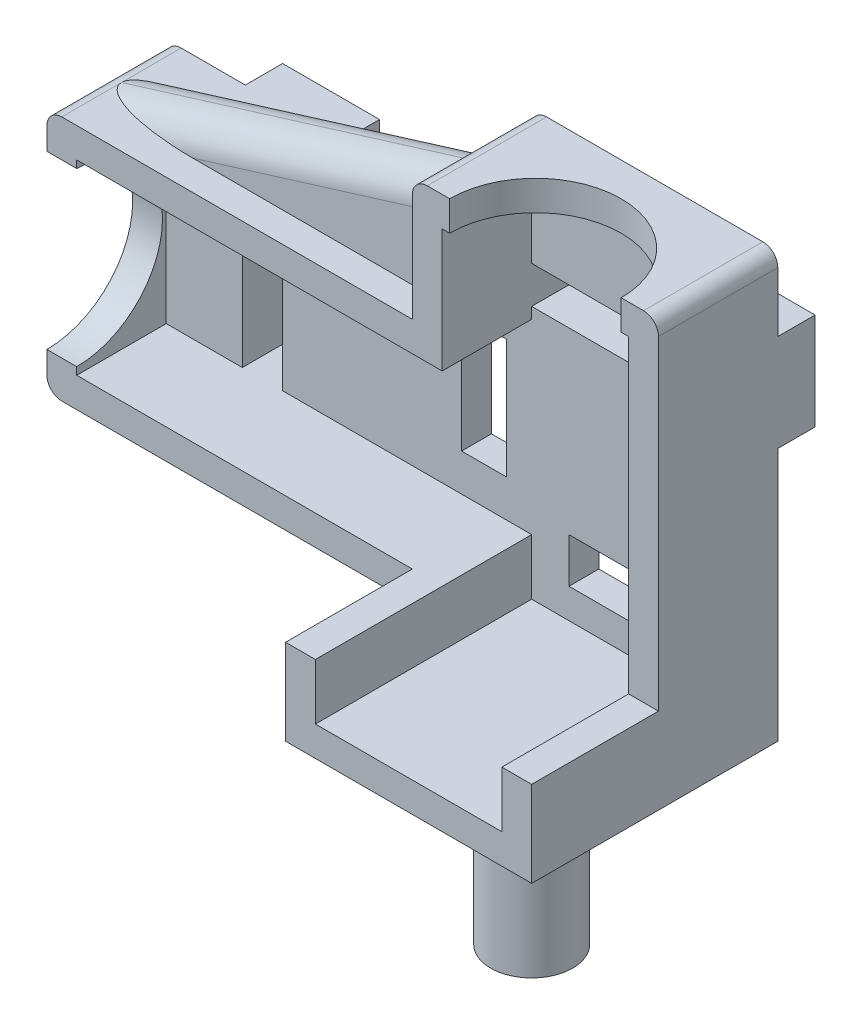
from build123d import *

# Parameters (mm, degrees)
EXTRUDE_1_DEPTH             = 8
CUT_EXTRUDE_2_DEPTH         = 6
SKETCH_3_R                  = 5.75
CUT_EXTRUDE_3_DEPTH         = 43.881377077
SKETCH_4_R                  = 5.75
CUT_EXTRUDE_4_DEPTH         = 43.285488054
SKETCH_10_W                 = 16.5
SKETCH_10_H                 = 6.5
EXTRUDE_3_DEPTH             = 2.5
EXTRUDE_4_OUTLINE_W         = 6.5
EXTRUDE_4_OUTLINE_H         = 16.5
EXTRUDE_4_DEPTH             = 2.5
SKETCH_12_W                 = 12.5
SKETCH_12_H                 = 2.5
CUT_EXTRUDE_8_DEPTH         = 37.216363705
CUT_EXTRUDE_START           = -4.5
CUT_EXTRUDE_9_OUTLINE_W     = 2.7
CUT_EXTRUDE_9_OUTLINE_H     = 12.5
CUT_EXTRUDE_9_DEPTH         = 4.5
EXTRUDE_5_REACH             = 39.227
SKETCH_15_W                 = 16.5
SKETCH_15_H                 = 5.75
EXTRUDE_5_DIRECTION_2_DEPTH = 8.5
SKETCH_16_W                 = 12.5
SKETCH_16_H                 = 3.75
CUT_EXTRUDE_11_DEPTH        = 14.5
SKETCH_17_R                 = 2.75
EXTRUDE_6_DEPTH             = 11.8
SKETCH_19_R                 = 1.5
CUT_EXTRUDE_12_DEPTH        = 2
SKETCH_20_W                 = 8
SKETCH_20_H                 = 3
CUT_EXTRUDE_13_DEPTH        = 45.287865155
SKETCH_22_W                 = 3
SKETCH_22_H                 = 8
CUT_EXTRUDE_14_DEPTH        = 45.287865155
FILLET_5_R                  = 1
FILLET_6_R                  = 1
RIB_3_REACH                 = 45.674
SKETCH_26_WALL_W            = 113.940860968
SKETCH_26_WALL_H            = 4
FILLET_12_R                 = 2
SKETCH_28_R                 = 0.5
EXTRUDE_7_DEPTH             = 0.8
FILLET_13_R                 = 0.15
EXTRUDE_START               = 0.8
SKETCH_31_R                 = 0.5
EXTRUDE_9_DEPTH             = 0.8
FILLET_14_R                 = 0.15
SKETCH_34_R                 = 0.5
EXTRUDE_10_DEPTH            = 0.8
FILLET_16_R                 = 0.15
SKETCH_35_R                 = 0.5
EXTRUDE_11_DEPTH            = 0.8
FILLET_17_R                 = 0.15
FILLET_5_OF_MIRROR_12_R     = 1
FILLET_6_OF_MIRROR_12_R     = 1
FILLET_12_OF_MIRROR_12_R    = 2
FILLET_13_OF_MIRROR_12_R    = 0.15
FILLET_14_OF_MIRROR_12_R    = 0.15
FILLET_16_OF_MIRROR_12_R    = 0.15
FILLET_17_OF_MIRROR_12_R    = 0.15
SKETCH_32_W                 = 34.689235526
SKETCH_32_H                 = 51.308413002
CUT_EXTRUDE_15_DEPTH        = 50.697610607


# Read off the part's stored shape, not the designer's step: 凸台-拉伸4, 切除-拉伸9
with BuildPart() as part:
    # 草图1 → 凸台-拉伸1 (new body)
    with BuildSketch(Plane.XY):
        Polygon((-8.25, 14.25), (8.25, 14.25), (8.25, 6), (32.75, 6), (32.75, -10.5), (8.25, -10.5), (8.25, -14.25), (-8.25, -14.25), align=None)
    extrude_1 = extrude(amount=-EXTRUDE_1_DEPTH)

    # 草图2 → 切除-拉伸2 (cut)
    with BuildSketch(Plane.XY):
        Polygon((-6.25, 12.25), (-6.25, -12.25), (6.25, -12.25), (6.25, -8.5), (30.75, -8.5), (30.75, 4), (6.25, 4), (6.25, 12.25), align=None)
    cut_extrude_2 = extrude(amount=-CUT_EXTRUDE_2_DEPTH, mode=Mode.SUBTRACT)

    # 草图3 → 切除-拉伸3 (cut, through all)
    with BuildSketch(Plane.XZ.offset(-12.25)):
        Circle(SKETCH_3_R)
    cut_extrude_3 = extrude(amount=-CUT_EXTRUDE_3_DEPTH, mode=Mode.SUBTRACT)

    # 草图4 → 切除-拉伸4 (cut, through all)
    with BuildSketch(Plane.ZY.offset(-30.75)):
        with Locations((0, -2.25)):
            Circle(SKETCH_4_R)
    cut_extrude_4 = extrude(amount=-CUT_EXTRUDE_4_DEPTH, mode=Mode.SUBTRACT)

    # 草图10 → 凸台-拉伸3 (add)
    with BuildSketch(Plane(origin=(0, 0, -8), x_dir=(-1, 0, 0), z_dir=(0, 0, -1))):
        with Locations((0, 6)):
            Rectangle(SKETCH_10_W, SKETCH_10_H)
    extrude_3 = extrude(amount=EXTRUDE_3_DEPTH)

    # 凸台-拉伸4 outline → 凸台-拉伸4 (add)
    with BuildSketch(Plane(origin=(0, 0, -8), x_dir=(-1, 0, 0), z_dir=(0, 0, -1))):
        with Locations((-24.2, -2.25)):
            Rectangle(EXTRUDE_4_OUTLINE_W, EXTRUDE_4_OUTLINE_H)
    extrude_4 = extrude(amount=EXTRUDE_4_DEPTH)

    # 草图12 → 切除-拉伸8 (cut, through all)
    with BuildSketch(Plane.XY.offset(-6)):
        with Locations((0, 6)):
            Rectangle(SKETCH_12_W, SKETCH_12_H)
    cut_extrude_8 = extrude(amount=-CUT_EXTRUDE_8_DEPTH, mode=Mode.SUBTRACT)

    # 切除-拉伸9 outline → 切除-拉伸9 (cut)
    with BuildSketch(Plane.XY.offset(-6).offset(CUT_EXTRUDE_START)):
        with Locations((24.3, -2.25)):
            Rectangle(CUT_EXTRUDE_9_OUTLINE_W, CUT_EXTRUDE_9_OUTLINE_H)
    cut_extrude_9 = extrude(amount=CUT_EXTRUDE_9_DEPTH, mode=Mode.SUBTRACT)

    # 草图15 → 凸台-拉伸5 (add, up to next)
    with BuildSketch(Plane.XY, mode=Mode.PRIVATE) as extrude_5_sk1:
        with Locations((0, -11.375)):
            Rectangle(SKETCH_15_W, SKETCH_15_H)
    extrude_5_tool1 = extrude(extrude_5_sk1.sketch, amount=-EXTRUDE_5_REACH, mode=Mode.PRIVATE) - part.part
    extrude_5 = extrude_5_tool1.solids().sort_by_distance((0, -11.375, 0))[0]
    add(extrude_5)

    # 草图15 → 凸台-拉伸5 direction 2 (add)
    with BuildSketch(Plane.XY):
        with Locations((0, -11.375)):
            Rectangle(SKETCH_15_W, SKETCH_15_H)
    extrude_5_direction_2 = extrude(amount=EXTRUDE_5_DIRECTION_2_DEPTH)

    # 草图16 → 切除-拉伸11 (cut)
    with BuildSketch(Plane.XY.offset(8.5)):
        with Locations((0, -10.375)):
            Rectangle(SKETCH_16_W, SKETCH_16_H)
    cut_extrude_11 = extrude(amount=-CUT_EXTRUDE_11_DEPTH, mode=Mode.SUBTRACT)

    # 草图17 → 凸台-拉伸6 (add)
    with BuildSketch(Plane.XZ.offset(14.25)):
        with Locations(Location((0, 0.25, 0), (0, 0, 270))):
            Circle(SKETCH_17_R)
    extrude_6 = extrude(amount=EXTRUDE_6_DEPTH)

    # 草图19 → 切除-拉伸12 (cut)
    with BuildSketch(Plane.XZ.offset(26.05)):
        with Locations(Location((0, 0.25, 0), (0, 0, 270))):
            Circle(SKETCH_19_R)
    cut_extrude_12 = extrude(amount=-CUT_EXTRUDE_12_DEPTH, mode=Mode.SUBTRACT)

    # 草图20 → 切除-拉伸13 (cut, through all)
    with BuildSketch(Plane.XY.offset(-6)):
        with Locations((-0.25, -8.75)):
            Rectangle(SKETCH_20_W, SKETCH_20_H)
    cut_extrude_13 = extrude(amount=-CUT_EXTRUDE_13_DEPTH, mode=Mode.SUBTRACT)

    # 草图22 → 切除-拉伸14 (cut, through all)
    with BuildSketch(Plane.XY.offset(-6)):
        with Locations((9.45, -2)):
            Rectangle(SKETCH_22_W, SKETCH_22_H)
    cut_extrude_14 = extrude(amount=-CUT_EXTRUDE_14_DEPTH, mode=Mode.SUBTRACT)

    # 圆角5
    fillet_5_edges = [part.edges().sort_by_distance(p)[0] for p in [
        (-8.25, 14.25, -4),
        (8.25, 14.25, -4),
    ]]
    fillet(fillet_5_edges, radius=FILLET_5_R)

    # 圆角6
    fillet_6_edges = [part.edges().sort_by_distance(p)[0] for p in [
        (32.75, 6, -4),
        (32.75, -10.5, -4),
    ]]
    fillet(fillet_6_edges, radius=FILLET_6_R)

    # 草图26 wall → 筋3 (add, up to next)
    with BuildSketch(Plane(origin=(20, 9.625, -4), x_dir=(0.955558946739, -0.29480010059, 0), z_dir=(0.29480010059, 0.955558946739, 0)), mode=Mode.PRIVATE) as rib_3_sk1:
        Rectangle(SKETCH_26_WALL_W, SKETCH_26_WALL_H)
    rib_3_tool1 = extrude(rib_3_sk1.sketch, amount=-RIB_3_REACH, mode=Mode.PRIVATE) - part.part
    rib_3 = rib_3_tool1.solids().sort_by_distance((20, 9.625, -4))[0]
    add(rib_3)

    # 圆角12
    fillet_12_edges = [part.edges().sort_by_distance(p)[0] for p in [
        (20, 9.625, -2),
        (20, 9.625, -6),
    ]]
    fillet(fillet_12_edges, radius=FILLET_12_R - 0.0001)  # a hair under: the kernel refuses the full size

    # 草图28 → 凸台-拉伸7 (add)
    with BuildSketch(Plane.XZ.offset(-7.25)):
        with Locations(Location((0, -8.25, 0), (0, 0, 90))):
            Circle(SKETCH_28_R)
    extrude_7 = extrude(amount=EXTRUDE_7_DEPTH)

    # 圆角13
    fillet_13_edges = [part.edges().sort_by_distance(p)[0] for p in [
        (0, 6.45, -8.75),
    ]]
    fillet(fillet_13_edges, radius=FILLET_13_R)

    # 草图31 → 凸台-拉伸9 (add)
    with BuildSketch(Plane(origin=(0, 4.75, 0), x_dir=(1, 0, 0), z_dir=(0, 1, 0)).offset(EXTRUDE_START)):
        with Locations(Location((0, 8.25, 0), (0, 0, 270))):
            Circle(SKETCH_31_R)
    extrude_9 = extrude(amount=-EXTRUDE_9_DEPTH)

    # 圆角14
    fillet_14_edges = [part.edges().sort_by_distance(p)[0] for p in [
        (0, 5.55, -8.75),
    ]]
    fillet(fillet_14_edges, radius=FILLET_14_R)

    # 草图34 → 凸台-拉伸10 (add)
    with BuildSketch(Plane.ZY.offset(-25.65)):
        with Locations((-8.25, -2.25)):
            Circle(SKETCH_34_R)
    extrude_10 = extrude(amount=EXTRUDE_10_DEPTH)

    # 圆角16
    fillet_16_edges = [part.edges().sort_by_distance(p)[0] for p in [
        (24.85, -2.25, -8.75),
    ]]
    fillet(fillet_16_edges, radius=FILLET_16_R)

    # 草图35 → 凸台-拉伸11 (add)
    with BuildSketch(Plane(origin=(22.95, 0, 0), x_dir=(0, 0, -1), z_dir=(1, 0, 0)).offset(EXTRUDE_START)):
        with Locations(Location((8.25, -2.25, 0), (0, 0, 180))):
            Circle(SKETCH_35_R)
    extrude_11 = extrude(amount=-EXTRUDE_11_DEPTH)

    # 圆角17
    fillet_17_edges = [part.edges().sort_by_distance(p)[0] for p in [
        (23.75, -2.25, -8.75),
    ]]
    fillet(fillet_17_edges, radius=FILLET_17_R)


with BuildPart() as mirror_12_1:
    # 镜向12: 凸台-拉伸1 across plane
    add(extrude_1.mirror(Plane.ZY.offset(8.25)))

    # Mirror 12 2: 切除-拉伸2, 切除-拉伸3, 切除-拉伸4 across plane
    add(cut_extrude_2.mirror(Plane.ZY.offset(8.25)), mode=Mode.SUBTRACT)
    add(cut_extrude_3.mirror(Plane.ZY.offset(8.25)), mode=Mode.SUBTRACT)
    add(cut_extrude_4.mirror(Plane.ZY.offset(8.25)), mode=Mode.SUBTRACT)


with BuildPart() as mirror_12_3_1:
    # Mirror 12 3: 凸台-拉伸3, 凸台-拉伸4 across plane
    add(extrude_3.mirror(Plane.ZY.offset(8.25)))
    add(extrude_4.mirror(Plane.ZY.offset(8.25)))


with BuildPart() as mirror_12_4_tool:
    # Mirror 12 4: 切除-拉伸8, 切除-拉伸9 across plane
    add(cut_extrude_8.mirror(Plane.ZY.offset(8.25)))
    add(cut_extrude_9.mirror(Plane.ZY.offset(8.25)))


with BuildPart() as mirror_12_1_1:
    add(mirror_12_1.part)

    # Mirror 12 4: cut by mirror_12_4_tool
    add(mirror_12_4_tool.part, mode=Mode.SUBTRACT)


with BuildPart() as mirror_12_3_1_1:
    add(mirror_12_3_1.part)

    # Mirror 12 4: cut by mirror_12_4_tool
    add(mirror_12_4_tool.part, mode=Mode.SUBTRACT)


with BuildPart() as mirror_12_5_1:
    # Mirror 12 5: 凸台-拉伸5, 凸台-拉伸5 direction 2 across plane
    add(extrude_5.mirror(Plane.ZY.offset(8.25)))
    add(extrude_5_direction_2.mirror(Plane.ZY.offset(8.25)))

    # Mirror 12 6: 切除-拉伸11 across plane
    add(cut_extrude_11.mirror(Plane.ZY.offset(8.25)), mode=Mode.SUBTRACT)


with BuildPart() as mirror_12_7_1:
    # Mirror 12 7: 凸台-拉伸6 across plane
    add(extrude_6.mirror(Plane.ZY.offset(8.25)))


with BuildPart() as mirror_12_8_tool:
    # Mirror 12 8: 切除-拉伸12, 切除-拉伸13, 切除-拉伸14 across plane
    add(cut_extrude_12.mirror(Plane.ZY.offset(8.25)))
    add(cut_extrude_13.mirror(Plane.ZY.offset(8.25)))
    add(cut_extrude_14.mirror(Plane.ZY.offset(8.25)))


with BuildPart() as mirror_12_1_2:
    add(mirror_12_1_1.part)

    # Mirror 12 8: cut by mirror_12_8_tool
    add(mirror_12_8_tool.part, mode=Mode.SUBTRACT)

    # 圆角5 of 镜向12
    fillet_5_of_mirror_12_edges = [mirror_12_1_2.edges().sort_by_distance(p)[0] for p in [
        (-8.25, 14.25, -4),
        (-24.75, 14.25, -4),
    ]]
    fillet(fillet_5_of_mirror_12_edges, radius=FILLET_5_OF_MIRROR_12_R)

    # 圆角6 of 镜向12
    fillet_6_of_mirror_12_edges = [mirror_12_1_2.edges().sort_by_distance(p)[0] for p in [
        (-49.25, 6, -4),
        (-49.25, -10.5, -4),
    ]]
    fillet(fillet_6_of_mirror_12_edges, radius=FILLET_6_OF_MIRROR_12_R)


with BuildPart() as mirror_12_7_1_1:
    add(mirror_12_7_1.part)

    # Mirror 12 8: cut by mirror_12_8_tool
    add(mirror_12_8_tool.part, mode=Mode.SUBTRACT)


with BuildPart() as mirror_12_9_1:
    # Mirror 12 9: 筋3, 凸台-拉伸7, 凸台-拉伸9, 凸台-拉伸10, 凸台-拉伸11 across plane
    add(rib_3.mirror(Plane.ZY.offset(8.25)))
    add(extrude_7.mirror(Plane.ZY.offset(8.25)))
    add(extrude_9.mirror(Plane.ZY.offset(8.25)))
    add(extrude_10.mirror(Plane.ZY.offset(8.25)))
    add(extrude_11.mirror(Plane.ZY.offset(8.25)))

    # 圆角12 of 镜向12
    fillet_12_of_mirror_12_edges = [mirror_12_9_1.edges().sort_by_distance(p)[0] for p in [
        (-36.5, 9.625, -2),
        (-36.5, 9.625, -6),
    ]]
    fillet(fillet_12_of_mirror_12_edges, radius=FILLET_12_OF_MIRROR_12_R - 0.0001)  # a hair under: the kernel refuses the full size

    # 圆角13 of 镜向12
    fillet_13_of_mirror_12_edges = [mirror_12_9_1.edges().sort_by_distance(p)[0] for p in [
        (-16.5, 6.45, -8.75),
    ]]
    fillet(fillet_13_of_mirror_12_edges, radius=FILLET_13_OF_MIRROR_12_R)

    # 圆角14 of 镜向12
    fillet_14_of_mirror_12_edges = [mirror_12_9_1.edges().sort_by_distance(p)[0] for p in [
        (-16.5, 5.55, -8.75),
    ]]
    fillet(fillet_14_of_mirror_12_edges, radius=FILLET_14_OF_MIRROR_12_R)

    # 圆角16 of 镜向12
    fillet_16_of_mirror_12_edges = [mirror_12_9_1.edges().sort_by_distance(p)[0] for p in [
        (-41.35, -2.25, -8.75),
    ]]
    fillet(fillet_16_of_mirror_12_edges, radius=FILLET_16_OF_MIRROR_12_R)

    # 圆角17 of 镜向12
    fillet_17_of_mirror_12_edges = [mirror_12_9_1.edges().sort_by_distance(p)[0] for p in [
        (-40.25, -2.25, -8.75),
    ]]
    fillet(fillet_17_of_mirror_12_edges, radius=FILLET_17_OF_MIRROR_12_R)


with BuildPart() as part_1:
    add(part.part)

    # 镜向12 united with what the copies to: union 镜向12_1, 镜向12 3_1, 镜向12 5_1, 镜向12 7_1, 镜向12 9_1
    add(mirror_12_1_2.part)
    add(mirror_12_3_1_1.part)
    add(mirror_12_5_1.part)
    add(mirror_12_7_1_1.part)
    add(mirror_12_9_1.part)

    # 草图32 → 切除-拉伸15 (cut, through all)
    with BuildSketch(Plane.ZY.offset(8.25)):
        with Locations((-0.725440287, -5.737573176)):
            Rectangle(SKETCH_32_W, SKETCH_32_H)
    extrude(amount=-CUT_EXTRUDE_15_DEPTH, mode=Mode.SUBTRACT)


solid = part_1.part
